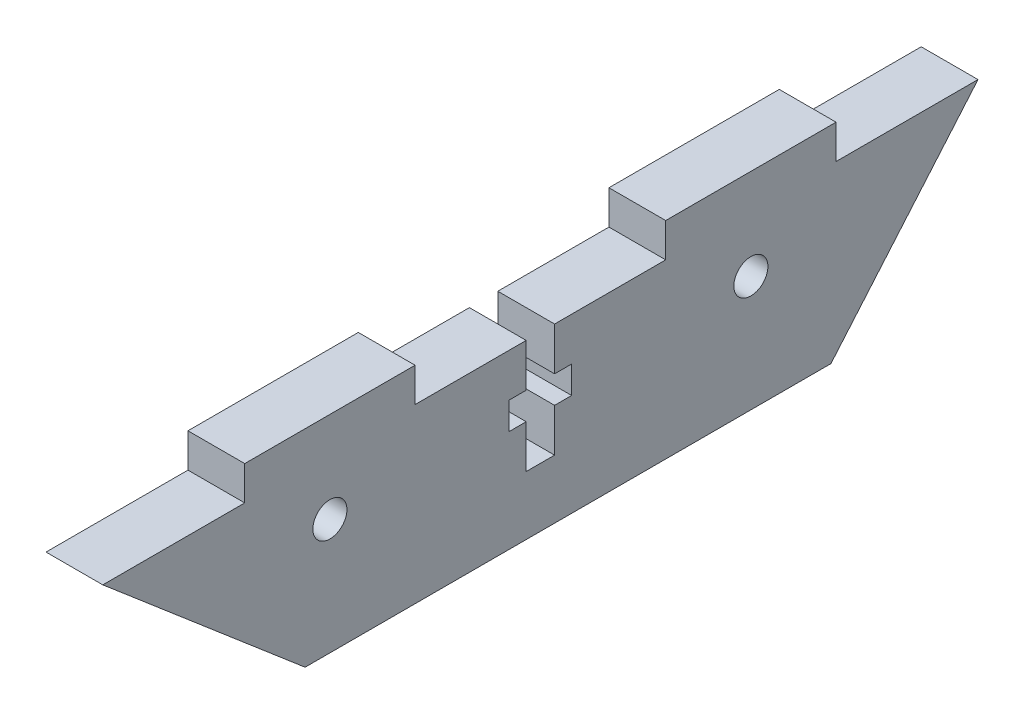
from build123d import *

# Parameters (mm, degrees)
SCHIZZO1_W                   = 77.07
SCHIZZO1_H                   = 15.19
ESTRUSIONE_ESTRUSIONE1_DEPTH = 5
TAGLIO_ESTRUSIONE1_DEPTH     = 40.593310672
SCHIZZO3_R                   = 1.5
TAGLIO_ESTRUSIONE2_DEPTH     = 40.593310672
SCHIZZO4_W                   = 5
SCHIZZO4_H                   = 15
ESTRUSIONE_ESTRUSIONE2_DEPTH = 3
TAGLIO_ESTRUSIONE3_DEPTH     = 41.276547146


with BuildPart() as part:
    # Schizzo1 → Estrusione-Estrusione1 (new body)
    with BuildSketch(Plane(origin=(0, 0, 0), x_dir=(0, 0, -1), z_dir=(1, 0, 0))):
        Rectangle(SCHIZZO1_W, SCHIZZO1_H)
    extrude(amount=ESTRUSIONE_ESTRUSIONE1_DEPTH)

    # Schizzo2 → Taglio-Estrusione1 (cut, through all)
    with BuildSketch(Plane(origin=(0, 0, 0), x_dir=(0, 0, -1), z_dir=(1, 0, 0))):
        Polygon((38.535, 7.595), (25.584422571, -7.595), (38.535, -7.595), align=None)
        Polygon((-38.535, 7.595), (-38.535, -7.595), (-20.718334969, -7.595), align=None)
    extrude(amount=TAGLIO_ESTRUSIONE1_DEPTH, mode=Mode.SUBTRACT)

    # Schizzo3 → Taglio-Estrusione2 (cut, through all)
    with BuildSketch(Plane(origin=(0, 0, 0), x_dir=(0, 0, -1), z_dir=(1, 0, 0))):
        with Locations((-18.535, 2.595)):
            Circle(SCHIZZO3_R)
        with Locations((18.535, 2.595)):
            Circle(SCHIZZO3_R)
    extrude(amount=TAGLIO_ESTRUSIONE2_DEPTH, mode=Mode.SUBTRACT)

    # Schizzo4 → Estrusione-Estrusione2 (add)
    with BuildSketch(Plane(origin=(0, 7.595, 0), x_dir=(1, 0, 0), z_dir=(0, 1, 0))):
        with Locations((2.5, 18.535)):
            Rectangle(SCHIZZO4_W, SCHIZZO4_H)
        with Locations((2.5, -18.535)):
            Rectangle(SCHIZZO4_W, SCHIZZO4_H)
    extrude(amount=ESTRUSIONE_ESTRUSIONE2_DEPTH)

    # Schizzo6 → Taglio-Estrusione3 (cut, through all)
    with BuildSketch(Plane(origin=(0, 0, 0), x_dir=(0, 0, -1), z_dir=(1, 0, 0))):
        Polygon((-1.25, -2.405), (-1.25, 1.395), (-2.75, 1.395), (-2.75, 3.795), (-1.25, 3.795), (-1.25, 7.595), (1.25, 7.595), (1.25, 3.795), (2.75, 3.795), (2.75, 1.395), (1.25, 1.395), (1.25, -2.405), align=None)
    extrude(amount=TAGLIO_ESTRUSIONE3_DEPTH, mode=Mode.SUBTRACT)


solid = part.part
